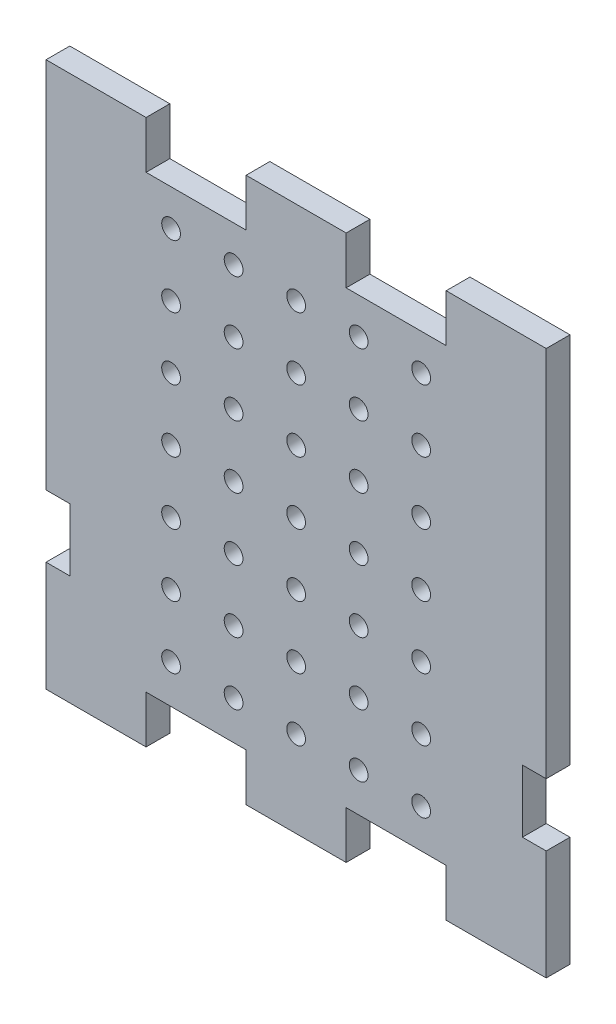
from build123d import *

# Parameters (mm, degrees)
BOSS_EXTRUDE1_DEPTH = 4.826
SKETCH2_R           = 1.905
CUT_EXTRUDE1_DEPTH  = 151.366498303
SKETCH4_W           = 4.826
SKETCH4_H           = 12.7
CUT_EXTRUDE2_DEPTH  = 151.366498303


with BuildPart() as part:
    # Sketch1 → Boss-Extrude1 (new body)
    with BuildSketch(Plane.XY):
        Polygon((0, 110.744), (0, 0), (20.32, 0), (20.32, 9.652), (40.64, 9.652), (40.64, 0), (60.96, 0), (60.96, 9.652), (81.28, 9.652), (81.28, 0), (101.6, 0), (101.6, 110.744), (81.28, 110.744), (81.28, 101.092), (60.96, 101.092), (60.96, 110.744), (40.64, 110.744), (40.64, 101.092), (20.32, 101.092), (20.32, 110.744), align=None)
    extrude(amount=BOSS_EXTRUDE1_DEPTH)

    # Sketch2 → Cut-Extrude1 (cut, through all)
    with BuildSketch(Plane.XY.offset(4.826)):
        with Locations((50.8, 68.326)):
            Circle(SKETCH2_R)
        with Locations((63.5, 68.326)):
            Circle(SKETCH2_R)
        with Locations((76.2, 68.326)):
            Circle(SKETCH2_R)
        with Locations((63.5, 81.026)):
            Circle(SKETCH2_R)
        with Locations((76.2, 81.026)):
            Circle(SKETCH2_R)
        with Locations((63.5, 93.726)):
            Circle(SKETCH2_R)
        with Locations((76.2, 93.726)):
            Circle(SKETCH2_R)
        with Locations((38.1, 68.326)):
            Circle(SKETCH2_R)
        with Locations((25.4, 68.326)):
            Circle(SKETCH2_R)
        with Locations((38.1, 81.026)):
            Circle(SKETCH2_R)
        with Locations((25.4, 81.026)):
            Circle(SKETCH2_R)
        with Locations((38.1, 93.726)):
            Circle(SKETCH2_R)
        with Locations((25.4, 93.726)):
            Circle(SKETCH2_R)
        with Locations((50.8, 81.026)):
            Circle(SKETCH2_R)
        with Locations((50.8, 93.726)):
            Circle(SKETCH2_R)
        with Locations((63.5, 55.626)):
            Circle(SKETCH2_R)
        with Locations((76.2, 55.626)):
            Circle(SKETCH2_R)
        with Locations((63.5, 42.926)):
            Circle(SKETCH2_R)
        with Locations((76.2, 42.926)):
            Circle(SKETCH2_R)
        with Locations((63.5, 30.226)):
            Circle(SKETCH2_R)
        with Locations((76.2, 30.226)):
            Circle(SKETCH2_R)
        with Locations((63.5, 17.526)):
            Circle(SKETCH2_R)
        with Locations((76.2, 17.526)):
            Circle(SKETCH2_R)
        with Locations((38.1, 55.626)):
            Circle(SKETCH2_R)
        with Locations((25.4, 55.626)):
            Circle(SKETCH2_R)
        with Locations((38.1, 42.926)):
            Circle(SKETCH2_R)
        with Locations((25.4, 42.926)):
            Circle(SKETCH2_R)
        with Locations((38.1, 30.226)):
            Circle(SKETCH2_R)
        with Locations((25.4, 30.226)):
            Circle(SKETCH2_R)
        with Locations((38.1, 17.526)):
            Circle(SKETCH2_R)
        with Locations((25.4, 17.526)):
            Circle(SKETCH2_R)
        with Locations((50.8, 55.626)):
            Circle(SKETCH2_R)
        with Locations((50.8, 42.926)):
            Circle(SKETCH2_R)
        with Locations((50.8, 30.226)):
            Circle(SKETCH2_R)
        with Locations((50.8, 17.526)):
            Circle(SKETCH2_R)
    extrude(amount=-CUT_EXTRUDE1_DEPTH, mode=Mode.SUBTRACT)

    # Sketch4 → Cut-Extrude2 (cut, through all)
    with BuildSketch(Plane.XY.offset(4.826)):
        with Locations((2.413, 28.702)):
            Rectangle(SKETCH4_W, SKETCH4_H)
        with Locations((99.187, 28.702)):
            Rectangle(SKETCH4_W, SKETCH4_H)
    extrude(amount=-CUT_EXTRUDE2_DEPTH, mode=Mode.SUBTRACT)


solid = part.part
